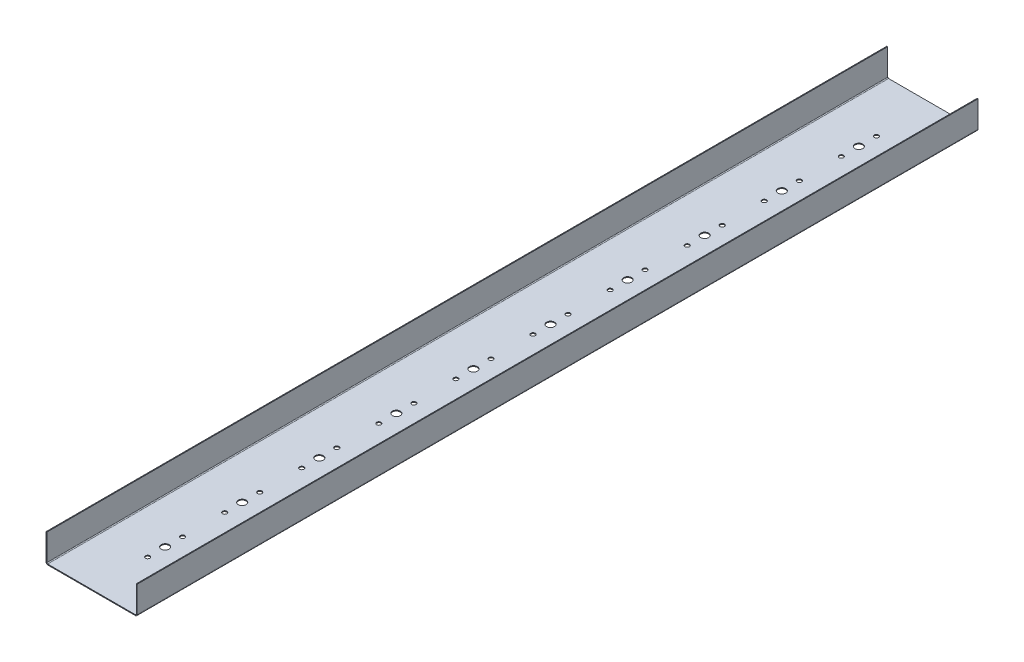
from build123d import *

# Parameters (mm, degrees)
BASE_FLANGE1_DEPTH             = 762
HOLE1_OUTLINE_R                = 7.14375
HOLE1_DEPTH                    = 1.4986
LPATTERN1_COUNT                = 10
LPATTERN1_PITCH                = 139.7
F_5_16_0_3125_DIAMETER_HOLE1_D = 7.9375
LPATTERN2_COUNT                = 10
LPATTERN2_PITCH                = 139.7


# Read off the part's stored shape, not the designer's step: Hole1
# Sheet-metal steps are written as plain solids
with BuildPart() as part:
    # Sketch1 → Base-Flange1 (new, symmetric)
    with BuildSketch(Plane.XY):
        with BuildLine():
            Line((82.55, 50.8), (82.55, 3.0861))
            ThreePointArc((82.55, 3.0861), (81.646102237, 0.903897763), (79.4639, 0))
            Line((79.4639, 0), (-79.4639, 0))
            ThreePointArc((-79.4639, 0), (-81.646102237, 0.903897763), (-82.55, 3.0861))
            Line((-82.55, 3.0861), (-82.55, 50.8))
            Line((-82.55, 50.8), (-81.0514, 50.8))
            Line((-81.0514, 50.8), (-81.0514, 3.0861))
            ThreePointArc((-81.0514, 3.0861), (-80.586432015, 1.963567985), (-79.4639, 1.4986))
            Line((-79.4639, 1.4986), (79.4639, 1.4986))
            ThreePointArc((79.4639, 1.4986), (80.586432015, 1.963567985), (81.0514, 3.0861))
            Line((81.0514, 3.0861), (81.0514, 50.8))
            Line((81.0514, 50.8), (82.55, 50.8))
        make_face()
    extrude(amount=BASE_FLANGE1_DEPTH, both=True)

    # Hole1 outline → Hole1 (cut)
    with BuildSketch(Plane(origin=(0, 0, 0), x_dir=(1, 0, 0), z_dir=(0, 1, 0))):
        with Locations((0, 628.65)):
            Circle(HOLE1_OUTLINE_R)
    hole1 = extrude(amount=HOLE1_DEPTH, mode=Mode.SUBTRACT)

    # LPattern1: Hole1 ×10
    with Locations(*[(0, 0, i * LPATTERN1_PITCH) for i in range(1, LPATTERN1_COUNT)]):
        add(hole1, mode=Mode.SUBTRACT)

    # 5/16 (0.3125) Diameter Hole1 (through all)
    with Locations(Plane(origin=(0, 0, 0), x_dir=(-1, 0, 0), z_dir=(0, -1, 0))):
        with Locations((0, 660.4), (0, 596.9)):
            f_5_16_0_3125_diameter_hole1 = Hole(F_5_16_0_3125_DIAMETER_HOLE1_D / 2)

    # LPattern2: 5/16 (0.3125) Diameter Hole1 ×10
    with Locations(*[(0, 0, i * LPATTERN2_PITCH) for i in range(1, LPATTERN2_COUNT)]):
        add(f_5_16_0_3125_diameter_hole1, mode=Mode.SUBTRACT)


solid = part.part
